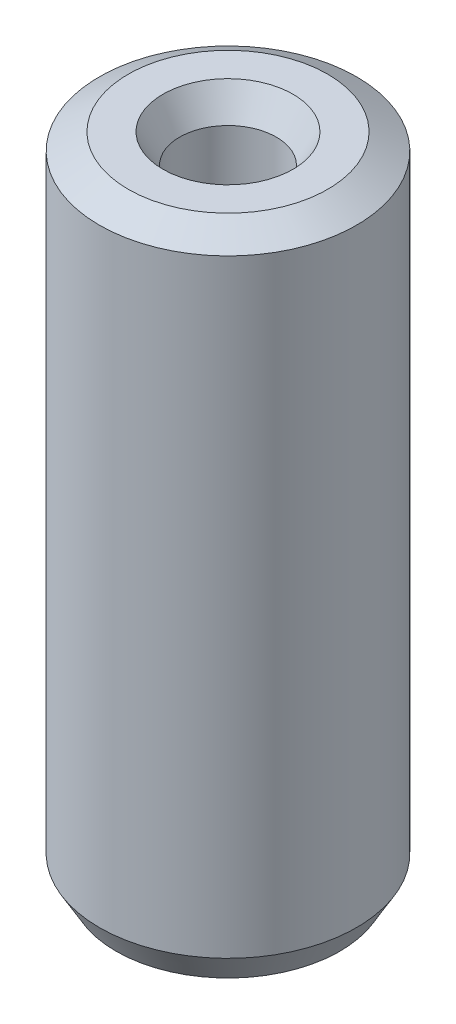
from build123d import *
from OCP.BRepFilletAPI import BRepFilletAPI_MakeChamfer

# Parameters (mm, degrees)
SKETCH1_R           = 30
BOSS_EXTRUDE1_DEPTH = 152.530745352
SKETCH2_R           = 11.294042272
CUT_EXTRUDE1_DEPTH  = 159.321281821
CHAMFER1_SIZE       = 3.883906793
CHAMFER1_SIZE2      = 6.727123897


with BuildPart() as part:
    # Sketch1 → Boss-Extrude1 (new body)
    with BuildSketch(Plane(origin=(0, 0, 0), x_dir=(1, 0, 0), z_dir=(0, 1, 0))):
        Circle(SKETCH1_R)
    extrude(amount=BOSS_EXTRUDE1_DEPTH)

    # Sketch2 → Cut-Extrude1 (cut, through all)
    with BuildSketch(Plane(origin=(0, 0, 0), x_dir=(1, 0, 0), z_dir=(0, 1, 0))):
        Circle(SKETCH2_R)
    extrude(amount=CUT_EXTRUDE1_DEPTH, mode=Mode.SUBTRACT)

    # Chamfer1: one chamfer whose edges measure the first distance from different faces: ONE call of the kernel's chamfer builder (chamfer() names one face for all edges)
    chamfer1_edges_1 = [part.edges().sort_by_distance(p)[0] for p in [
        (-11.294042272, 152.530745352, 0),
    ]]
    chamfer1_side_1 = [part.faces().sort_by_distance(p)[0] for p in [
        (-29.151471863, 152.530745352, 0),
    ]]
    chamfer1_edges_2 = [part.edges().sort_by_distance(p)[0] for p in [
        (-11.294042272, 0, 0),
    ]]
    chamfer1_side_2 = [part.faces().sort_by_distance(p)[0] for p in [
        (-11.294042272, 76.265372676, 0),
    ]]
    chamfer1_edges_3 = [part.edges().sort_by_distance(p)[0] for p in [
        (-30, 0, 0),
    ]]
    chamfer1_side_3 = [part.faces().sort_by_distance(p)[0] for p in [
        (-29.151471863, 0, 0),
    ]]
    chamfer1_edges_4 = [part.edges().sort_by_distance(p)[0] for p in [
        (-30, 152.530745352, 0),
    ]]
    chamfer1_side_4 = [part.faces().sort_by_distance(p)[0] for p in [
        (-30, 76.265372676, 0),
    ]]
    chamfer1 = BRepFilletAPI_MakeChamfer(part.part.solid().wrapped)
    for e in chamfer1_edges_1:
        chamfer1.Add(CHAMFER1_SIZE, CHAMFER1_SIZE2, e.wrapped, chamfer1_side_1[0].wrapped)  # the first distance lies on this face
    for e in chamfer1_edges_2:
        chamfer1.Add(CHAMFER1_SIZE, CHAMFER1_SIZE2, e.wrapped, chamfer1_side_2[0].wrapped)  # the first distance lies on this face
    for e in chamfer1_edges_3:
        chamfer1.Add(CHAMFER1_SIZE, CHAMFER1_SIZE2, e.wrapped, chamfer1_side_3[0].wrapped)  # the first distance lies on this face
    for e in chamfer1_edges_4:
        chamfer1.Add(CHAMFER1_SIZE, CHAMFER1_SIZE2, e.wrapped, chamfer1_side_4[0].wrapped)  # the first distance lies on this face
    add(Compound.cast(chamfer1.Shape()), mode=Mode.REPLACE)


solid = part.part
